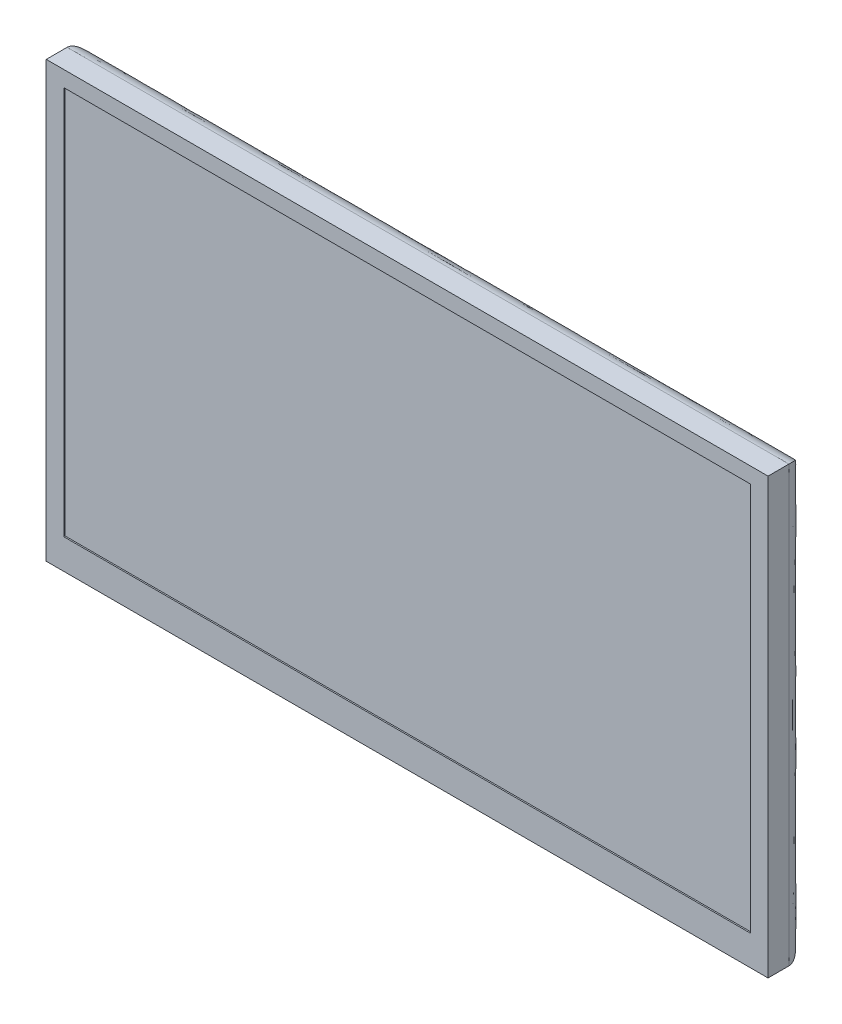
from build123d import *

# Parameters (mm, degrees)
SKETCH_1_W          = 553
SKETCH_1_H          = 333
EXTRUDE_1_DEPTH     = 56
FILLET_1_SIZE       = 40
FILLET_1_SIZE_2     = 150
SKETCH_2_W          = 526
SKETCH_2_H          = 298
CUT_EXTRUDE_1_DEPTH = 1
SKETCH_3_W          = 90
SKETCH_3_H          = 7.88506372
EXTRUDE_2_DEPTH     = 3


with BuildPart() as part:
    # Эскиз1 → Бобышка-Вытянуть1 (new body)
    with BuildSketch(Plane.XY):
        with Locations((219.863599641, -140.079802513)):
            Rectangle(SKETCH_1_W, SKETCH_1_H)
    extrude(amount=-EXTRUDE_1_DEPTH)

    # Скругление1
    # an asymmetric fillet: 150, 40 mm, written as the material it takes off along each edge
    with BuildSketch(Plane(origin=(496.363599641, -306.579802513, -56), x_dir=(0, 0, 1), z_dir=(-1, 0, 0)), Plane(origin=(-56.636400359, 26.420197487, -56), x_dir=(0, 0, 1), z_dir=(1, 0, 0))) as fillet_1_piece_1:
        with BuildLine():
            Bezier((FILLET_1_SIZE, 0), (0, 0), (0, FILLET_1_SIZE_2), weights=[1, 0.707106781, 1])
            Line((0, FILLET_1_SIZE_2), (-3, 150))
            Line((-3, 150), (-3, -3))
            Line((-3, -3), (40, -3))
            Line((40, -3), (FILLET_1_SIZE, 0))
        make_face()
    extrude(amount=553, mode=Mode.SUBTRACT)
    with BuildSketch(Plane(origin=(-56.636400359, -306.579802513, -56), x_dir=(0, 0, 1), z_dir=(0, 1, 0)), Plane(origin=(496.363599641, 26.420197487, -56), x_dir=(0, 0, 1), z_dir=(0, -1, 0))) as fillet_1_piece_2:
        with BuildLine():
            Bezier((FILLET_1_SIZE, 0), (0, 0), (0, FILLET_1_SIZE_2), weights=[1, 0.707106781, 1])
            Line((0, FILLET_1_SIZE_2), (-3, 150))
            Line((-3, 150), (-3, -3))
            Line((-3, -3), (40, -3))
            Line((40, -3), (FILLET_1_SIZE, 0))
        make_face()
    extrude(amount=333, mode=Mode.SUBTRACT)
    with BuildSketch(Plane(origin=(496.363599641, 26.420197487, -56), x_dir=(0, 0, 1), z_dir=(0, -1, 0))) as fillet_1_piece_3a_section:
        with BuildLine():
            Bezier((FILLET_1_SIZE, 0), (0, 0), (0, FILLET_1_SIZE_2), weights=[1, 0.707106781, 1])
            Line((0, FILLET_1_SIZE_2), (-3, 150))
            Line((-3, 150), (-3, -3))
            Line((-3, -3), (40, -3))
            Line((40, -3), (FILLET_1_SIZE, 0))
        make_face()
    fillet_1_piece_3a = extrude(amount=708, mode=Mode.PRIVATE)
    fillet_1_piece_3a = split(fillet_1_piece_3a, bisect_by=Plane(origin=(455.274079594, -306.579802513, -48.919820082), z_dir=(0, -1, 0)), keep=Keep.TOP, mode=Mode.PRIVATE)
    with BuildSketch(Plane(origin=(871.363599641, -306.579802513, -56), x_dir=(0, 0, 1), z_dir=(-1, 0, 0))) as fillet_1_piece_3b_section:
        with BuildLine():
            Bezier((FILLET_1_SIZE, 0), (0, 0), (0, FILLET_1_SIZE_2), weights=[1, 0.707106781, 1])
            Line((0, FILLET_1_SIZE_2), (-3, 150))
            Line((-3, 150), (-3, -3))
            Line((-3, -3), (40, -3))
            Line((40, -3), (FILLET_1_SIZE, 0))
        make_face()
    fillet_1_piece_3b = extrude(amount=928, mode=Mode.PRIVATE)
    fillet_1_piece_3b = split(fillet_1_piece_3b, bisect_by=Plane(origin=(496.363599641, -265.490295874, -48.919826396), z_dir=(1, 0, 0)), keep=Keep.TOP, mode=Mode.PRIVATE)
    fillet_1_piece_3 = fillet_1_piece_3a & fillet_1_piece_3b
    add(fillet_1_piece_3, mode=Mode.SUBTRACT)
    with BuildSketch(Plane(origin=(496.363599641, -306.579802513, -56), x_dir=(0, 0, 1), z_dir=(-1, 0, 0))) as fillet_1_piece_4a_section:
        with BuildLine():
            Bezier((FILLET_1_SIZE, 0), (0, 0), (0, FILLET_1_SIZE_2), weights=[1, 0.707106781, 1])
            Line((0, FILLET_1_SIZE_2), (-3, 150))
            Line((-3, 150), (-3, -3))
            Line((-3, -3), (40, -3))
            Line((40, -3), (FILLET_1_SIZE, 0))
        make_face()
    fillet_1_piece_4a = extrude(amount=928, mode=Mode.PRIVATE)
    fillet_1_piece_4a = split(fillet_1_piece_4a, bisect_by=Plane(origin=(-56.636400359, -265.49028305, -48.919819953), z_dir=(-1, 0, 0)), keep=Keep.TOP, mode=Mode.PRIVATE)
    with BuildSketch(Plane(origin=(-56.636400359, -681.579802513, -56), x_dir=(0, 0, 1), z_dir=(0, 1, 0))) as fillet_1_piece_4b_section:
        with BuildLine():
            Bezier((FILLET_1_SIZE, 0), (0, 0), (0, FILLET_1_SIZE_2), weights=[1, 0.707106781, 1])
            Line((0, FILLET_1_SIZE_2), (-3, 150))
            Line((-3, 150), (-3, -3))
            Line((-3, -3), (40, -3))
            Line((40, -3), (FILLET_1_SIZE, 0))
        make_face()
    fillet_1_piece_4b = extrude(amount=708, mode=Mode.PRIVATE)
    fillet_1_piece_4b = split(fillet_1_piece_4b, bisect_by=Plane(origin=(-15.546893136, -306.579802513, -48.919826525), z_dir=(0, -1, 0)), keep=Keep.TOP, mode=Mode.PRIVATE)
    fillet_1_piece_4 = fillet_1_piece_4a & fillet_1_piece_4b
    add(fillet_1_piece_4, mode=Mode.SUBTRACT)
    with BuildSketch(Plane(origin=(-431.636400359, 26.420197487, -56), x_dir=(0, 0, 1), z_dir=(1, 0, 0))) as fillet_1_piece_5a_section:
        with BuildLine():
            Bezier((FILLET_1_SIZE, 0), (0, 0), (0, FILLET_1_SIZE_2), weights=[1, 0.707106781, 1])
            Line((0, FILLET_1_SIZE_2), (-3, 150))
            Line((-3, 150), (-3, -3))
            Line((-3, -3), (40, -3))
            Line((40, -3), (FILLET_1_SIZE, 0))
        make_face()
    fillet_1_piece_5a = extrude(amount=928, mode=Mode.PRIVATE)
    fillet_1_piece_5a = split(fillet_1_piece_5a, bisect_by=Plane(origin=(-56.636400359, -14.669309261, -48.919826397), z_dir=(-1, 0, 0)), keep=Keep.TOP, mode=Mode.PRIVATE)
    with BuildSketch(Plane(origin=(-56.636400359, -306.579802513, -56), x_dir=(0, 0, 1), z_dir=(0, 1, 0))) as fillet_1_piece_5b_section:
        with BuildLine():
            Bezier((FILLET_1_SIZE, 0), (0, 0), (0, FILLET_1_SIZE_2), weights=[1, 0.707106781, 1])
            Line((0, FILLET_1_SIZE_2), (-3, 150))
            Line((-3, 150), (-3, -3))
            Line((-3, -3), (40, -3))
            Line((40, -3), (FILLET_1_SIZE, 0))
        make_face()
    fillet_1_piece_5b = extrude(amount=708, mode=Mode.PRIVATE)
    fillet_1_piece_5b = split(fillet_1_piece_5b, bisect_by=Plane(origin=(-15.546880312, 26.420197487, -48.919820082), z_dir=(0, 1, 0)), keep=Keep.TOP, mode=Mode.PRIVATE)
    fillet_1_piece_5 = fillet_1_piece_5a & fillet_1_piece_5b
    add(fillet_1_piece_5, mode=Mode.SUBTRACT)
    with BuildSketch(Plane(origin=(-56.636400359, 26.420197487, -56), x_dir=(0, 0, 1), z_dir=(1, 0, 0))) as fillet_1_piece_6a_section:
        with BuildLine():
            Bezier((FILLET_1_SIZE, 0), (0, 0), (0, FILLET_1_SIZE_2), weights=[1, 0.707106781, 1])
            Line((0, FILLET_1_SIZE_2), (-3, 150))
            Line((-3, 150), (-3, -3))
            Line((-3, -3), (40, -3))
            Line((40, -3), (FILLET_1_SIZE, 0))
        make_face()
    fillet_1_piece_6a = extrude(amount=928, mode=Mode.PRIVATE)
    fillet_1_piece_6a = split(fillet_1_piece_6a, bisect_by=Plane(origin=(496.363599641, -14.669322085, -48.919819954), z_dir=(1, 0, 0)), keep=Keep.TOP, mode=Mode.PRIVATE)
    with BuildSketch(Plane(origin=(496.363599641, 401.420197487, -56), x_dir=(0, 0, 1), z_dir=(0, -1, 0))) as fillet_1_piece_6b_section:
        with BuildLine():
            Bezier((FILLET_1_SIZE, 0), (0, 0), (0, FILLET_1_SIZE_2), weights=[1, 0.707106781, 1])
            Line((0, FILLET_1_SIZE_2), (-3, 150))
            Line((-3, 150), (-3, -3))
            Line((-3, -3), (40, -3))
            Line((40, -3), (FILLET_1_SIZE, 0))
        make_face()
    fillet_1_piece_6b = extrude(amount=708, mode=Mode.PRIVATE)
    fillet_1_piece_6b = split(fillet_1_piece_6b, bisect_by=Plane(origin=(455.274092417, 26.420197487, -48.919826525), z_dir=(0, 1, 0)), keep=Keep.TOP, mode=Mode.PRIVATE)
    fillet_1_piece_6 = fillet_1_piece_6a & fillet_1_piece_6b
    add(fillet_1_piece_6, mode=Mode.SUBTRACT)

    # Эскиз2 → Вырез-Вытянуть1 (cut)
    with BuildSketch(Plane.XY):
        with Locations((219.863599641, -134.579802513)):
            Rectangle(SKETCH_2_W, SKETCH_2_H)
    extrude(amount=-CUT_EXTRUDE_1_DEPTH, mode=Mode.SUBTRACT)

    # Эскиз3 → Бобышка-Вытянуть2 (add)
    with BuildSketch(Plane.XZ.offset(306.579802513)):
        with Locations((416.363599641, -8.14121692)):
            Rectangle(SKETCH_3_W, SKETCH_3_H)
    extrude(amount=EXTRUDE_2_DEPTH)


solid = part.part
